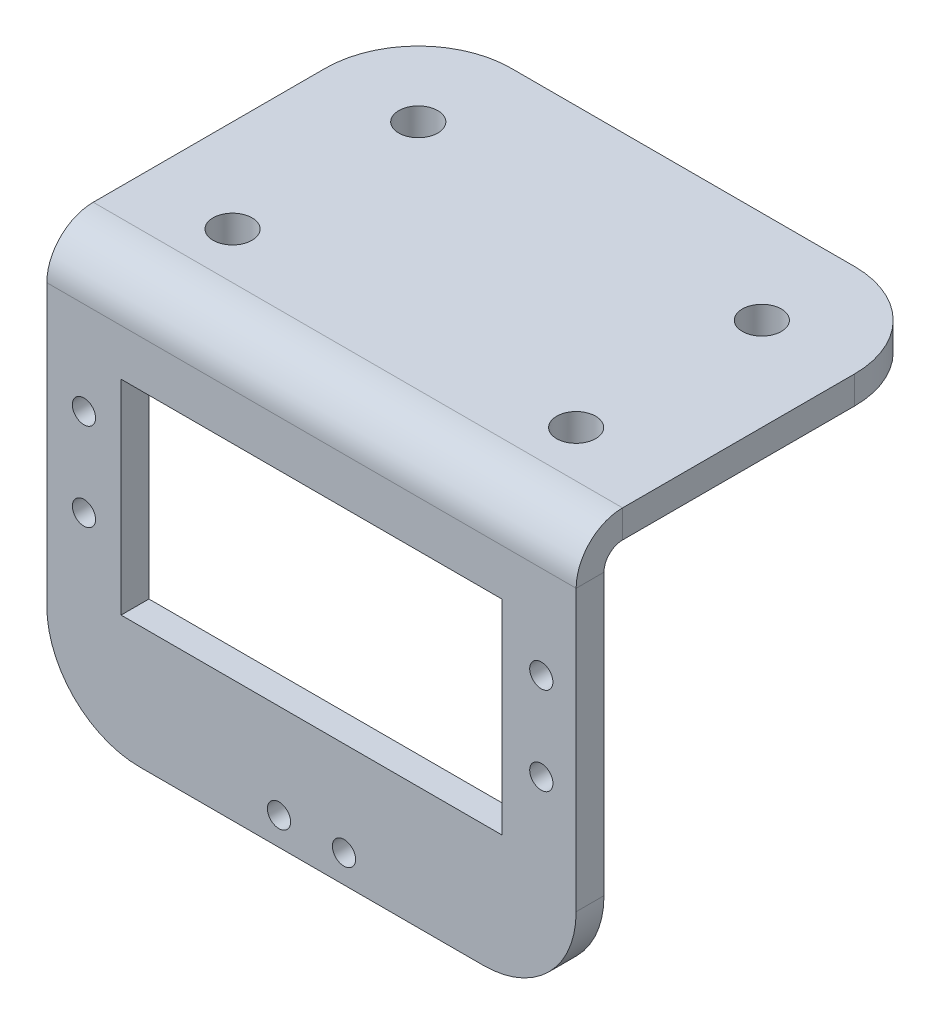
from build123d import *

# Parameters (mm, degrees)
SKETCH_1_W                       = 57
SKETCH_1_H                       = 45.164593648
SKETCH_1_R                       = 1.25
EXTRUDE_1_DEPTH                  = 3
SM_EDGE_FLANGE_1_STRIP_W         = 16
SM_EDGE_FLANGE_1_STRIP_H         = 3
SM_EDGE_FLANGE_1_STRIP_CUT_DEPTH = 57
SM_EDGE_FLANGE_1_DEPTH           = 57
SKETCH_9_R                       = 2.1
CUT_EXTRUDE_1_DEPTH              = 10
FILLET_1_R                       = 10


# Sheet-metal steps are written as plain solids
with BuildPart() as part:
    # Sketch 1 → 填料-伸長1 (new body)
    with BuildSketch(Plane.XY):
        with Locations((28.5, -12.582296824)):
            Rectangle(SKETCH_1_W, SKETCH_1_H)
        Polygon((8, -22), (8, 0), (49, 0), (49, -14.454593648), (49, -22), align=None, mode=Mode.SUBTRACT)
        with Locations((25, -32.164593648)):
            Circle(SKETCH_1_R, mode=Mode.SUBTRACT)
        with Locations((4, -14.454593648)):
            Circle(SKETCH_1_R, mode=Mode.SUBTRACT)
        with Locations((32, -32.164593648)):
            Circle(SKETCH_1_R, mode=Mode.SUBTRACT)
        with Locations((53.25, -14.454593648)):
            Circle(SKETCH_1_R, mode=Mode.SUBTRACT)
        with Locations((4, -5)):
            Circle(SKETCH_1_R, mode=Mode.SUBTRACT)
        with Locations((53.25, -5)):
            Circle(SKETCH_1_R, mode=Mode.SUBTRACT)
    extrude(amount=EXTRUDE_1_DEPTH)

    # 邊線-凸緣1 strip (across the edge) → 邊線-凸緣1 strip cut (cut)
    with BuildSketch(Plane(origin=(0, 10, 0), x_dir=(0, -1, 0), z_dir=(1, 0, 0))):
        with Locations((-3, -1.5)):
            Rectangle(SM_EDGE_FLANGE_1_STRIP_W, SM_EDGE_FLANGE_1_STRIP_H)
    extrude(amount=SM_EDGE_FLANGE_1_STRIP_CUT_DEPTH, mode=Mode.SUBTRACT)

    # 邊線-凸緣1 section (across the edge) → 邊線-凸緣1 (add)
    with BuildSketch(Plane(origin=(0, 10, 0), x_dir=(0, -1, 0), z_dir=(1, 0, 0))):
        with BuildLine():
            Line((0, 2), (0, 37))
            Line((0, 37), (3, 37))
            Line((3, 37), (3, 2))
            ThreePointArc((3, 2), (3.585786438, 0.585786438), (5, 0))
            Line((5, 0), (5, -3))
            ThreePointArc((5, -3), (1.464466094, -1.535533906), (0, 2))
        make_face()
    extrude(amount=SM_EDGE_FLANGE_1_DEPTH)

    # 草圖9 → 除料-伸長1 (cut)
    with BuildSketch(Plane(origin=(0, 7, 0), x_dir=(-1, 0, 0), z_dir=(0, -1, 0))):
        with Locations(Location((-10, 27, 0), (0, 0, 90))):
            Circle(SKETCH_9_R)
        with Locations(Location((-47, 27, 0), (0, 0, 90))):
            Circle(SKETCH_9_R)
        with Locations(Location((-10, 7, 0), (0, 0, 90))):
            Circle(SKETCH_9_R)
        with Locations(Location((-47, 7, 0), (0, 0, 90))):
            Circle(SKETCH_9_R)
    extrude(amount=-CUT_EXTRUDE_1_DEPTH, mode=Mode.SUBTRACT)

    # 圓角1
    fillet_1_edges = [part.edges().sort_by_distance(p)[0] for p in [
        (57, -35.164593648, 1.5),
        (0, -35.164593648, 1.5),
        (0, 8.5, -37),
        (57, 8.5, -37),
    ]]
    fillet(fillet_1_edges, radius=FILLET_1_R)


solid = part.part
